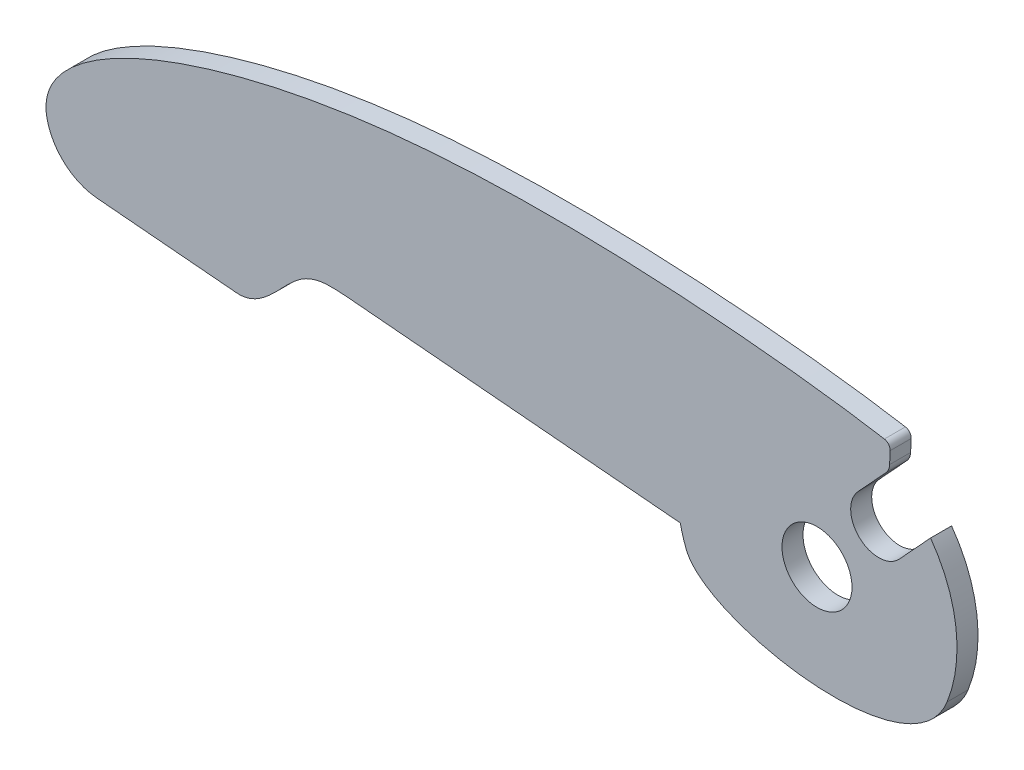
from build123d import *

# Parameters (mm, degrees)
SKICA1_R                = 2.5
P_IDAT_VYSUNUT_M1_DEPTH = 0.75


with BuildPart() as part:
    # Skica1 → Přidat vysunutím1 (new, symmetric)
    with BuildSketch(Plane.XY):
        with BuildLine():
            Line((5.225466632, 9.806261734), (5.185928538, 8.924675789))
            ThreePointArc((5.185928538, 8.924675789), (5.110031253, 8.584916032), (4.922257113, 8.291764257))
            Line((4.922257113, 8.291764257), (2.934500817, 6.135039116))
            ThreePointArc((2.934500817, 6.135039116), (3.049718939, 3.308959715), (5.875798341, 3.424177837))
            Line((5.875798341, 3.424177837), (8.110875659, 5.849247476))
            ThreePointArc((8.110875659, 5.849247476), (9.924883071, 1.223395284), (9.288523061, -3.704502578))
            add(Edge.make_bspline(
                [(9.288523061, -3.704502578), (6.818854676, -9.896851285), (-7.914945877, -7.30435704), (-9.341973011, -3.567567836)],
                knots=[0, 0, 0, 0, 1, 1, 1, 1], degree=3))
            ThreePointArc((-9.341973011, -3.567567836), (-9.579258622, -2.870157533), (-9.764558976, -2.157171298))
            Line((-9.764558976, -2.157171298), (-33.456460819, -0.084398469))
            add(Edge.make_bspline(
                [(-41.456460819, -3.76937373), (-39.796136322, -3.914633301), (-37.054793244, 0.064379819), (-35.116785316, 0.060861102), (-33.456460819, -0.084398469)],
                knots=[0, 0, 0, 0, 0.457392507, 1, 1, 1, 1], degree=3))
            Line((-41.456460819, -3.76937373), (-51.4184078, -2.897816303))
            ThreePointArc((-51.4184078, -2.897816303), (-53.748630988, -1.886538688), (-55, 0.324049043))
            add(Edge.make_bspline(
                [(4.812792818, 10.321067504), (-0.439515198, 11.247191119), (-32.097973841, 15.080973729), (-55.954044977, 5.23218496), (-55, 0.324049043)],
                knots=[0, 0, 0, 0, 0.525665788, 0.985260281, 0.985260281, 0.985260281, 0.985260281], degree=3))
            ThreePointArc((4.812792818, 10.321067504), (5.116096419, 10.141394159), (5.225466632, 9.806261734))
        make_face()
        Circle(SKICA1_R, mode=Mode.SUBTRACT)
    extrude(amount=P_IDAT_VYSUNUT_M1_DEPTH, both=True)


solid = part.part
